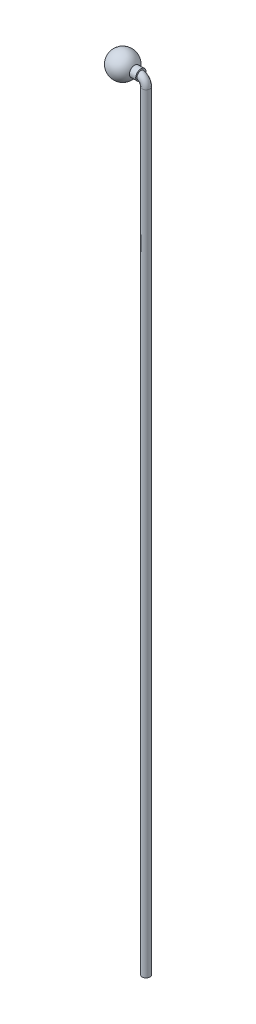
from build123d import *

# Parameters (mm, degrees)
SKETCH1_R           = 0.15
SKETCH6_R           = 0.2
BOSS_EXTRUDE1_DEPTH = 0.7


with BuildPart() as part:
    # Sweep1: sweep along a path in Sketch3
    with BuildLine(Plane.XY) as sweep1_path:
        Line((0, 0), (0.6, 0))
        ThreePointArc((0.6, 0), (0.812132034, -0.087867966), (0.9, -0.3))
        Line((0.9, -0.3), (0.9, -30))
    # Sketch1 → Sweep1 (sweep)
    with BuildSketch(Plane(origin=(0, 0, 0), x_dir=(0, 0, -1), z_dir=(1, 0, 0))):
        Circle(SKETCH1_R)
    sweep(path=sweep1_path.line)

    # Sketch6 → Boss-Extrude1 (add)
    with BuildSketch(Plane.ZY):
        Circle(SKETCH6_R)
    extrude(amount=-BOSS_EXTRUDE1_DEPTH)

    # Sketch4 → Revolve2 (revolve)
    with BuildSketch(Plane.ZY):
        with BuildLine():
            Line((0, 0.5), (0, -0.5))
            ThreePointArc((0, -0.5), (-0.5, 0), (0, 0.5))
        make_face()
    revolve(axis=Axis((0, 0.5, 0), (0, -1, 0)))


solid = part.part
